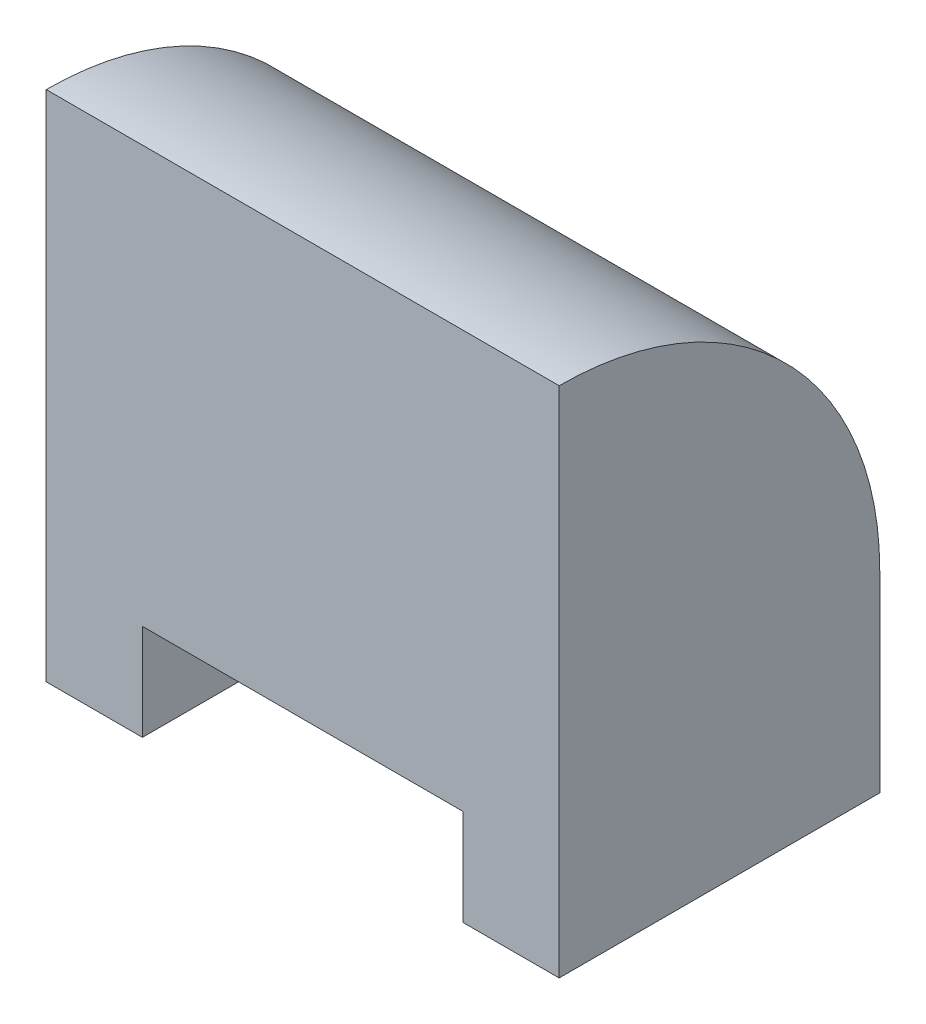
from build123d import *

# Parameters (mm, degrees)
SKETCH1_W           = 50
SKETCH1_H           = 80
BOSS_EXTRUDE1_DEPTH = 80
SKETCH4_W           = 50
SKETCH4_H           = 15
CUT_EXTRUDE2_DEPTH  = 124.693168769
FILLET1_R           = 50
SKETCH5_R           = 5
CUT_EXTRUDE3_DEPTH  = 25


with BuildPart() as part:
    # Sketch1 → Boss-Extrude1 (new body)
    with BuildSketch(Plane(origin=(0, 0, 0), x_dir=(0, 0, -1), z_dir=(1, 0, 0))):
        with Locations((25, 40)):
            Rectangle(SKETCH1_W, SKETCH1_H)
    extrude(amount=BOSS_EXTRUDE1_DEPTH)

    # Sketch4 → Cut-Extrude2 (cut, through all)
    with BuildSketch(Plane.XY):
        with Locations((40, 7.5)):
            Rectangle(SKETCH4_W, SKETCH4_H)
    extrude(amount=-CUT_EXTRUDE2_DEPTH, mode=Mode.SUBTRACT)

    # Fillet1
    fillet1_edges = [part.edges().sort_by_distance(p)[0] for p in [
        (40, 80, -50),
    ]]
    fillet(fillet1_edges, radius=FILLET1_R - 0.0001)  # a hair under: the kernel refuses the full size

    # Sketch5 → Cut-Extrude3 (cut)
    with BuildSketch(Plane.XZ.offset(-15)):
        with Locations(Location((40, -25, 0), (0, 0, 270))):
            Circle(SKETCH5_R)
    extrude(amount=-CUT_EXTRUDE3_DEPTH, mode=Mode.SUBTRACT)


solid = part.part
